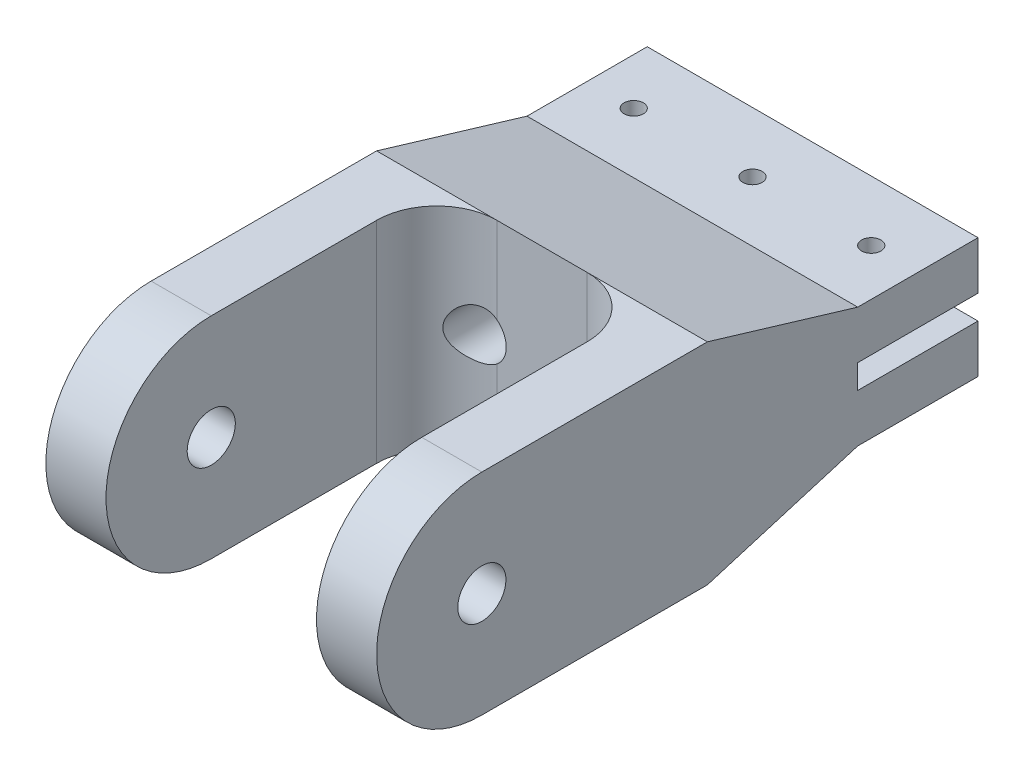
from build123d import *

# Parameters (mm, degrees)
CROQUIS1_W              = 55
CROQUIS1_H              = 35
SALIENTE_EXTRUIR1_DEPTH = 100
CROQUIS2_R              = 4
CORTAR_EXTRUIR1_DEPTH   = 100
CROQUIS3_W              = 35
CROQUIS3_H              = 55
CORTAR_EXTRUIR2_DEPTH   = 39
CROQUIS6_W              = 20
CROQUIS6_H              = 4
CORTAR_EXTRUIR3_DEPTH   = 55
CROQUIS7_R              = 4.05
CORTAR_EXTRUIR4_DEPTH   = 55
REDONDEO1_R             = 10
REDONDEO2_R             = 10
CROQUIS8_R              = 1.6
CORTAR_EXTRUIR5_DEPTH   = 20


with BuildPart() as part:
    # Croquis1 → Saliente-Extruir1 (new body)
    with BuildSketch(Plane.XY):
        Rectangle(CROQUIS1_W, CROQUIS1_H)
    extrude(amount=SALIENTE_EXTRUIR1_DEPTH)

    # Croquis2 → Cortar-Extruir1 (cut)
    with BuildSketch(Plane(origin=(27.5, 0, 0), x_dir=(0, 0, -1), z_dir=(1, 0, 0))):
        with Locations(Location((-82.5, 0, 0), (0, 0, 90))):
            Circle(CROQUIS2_R)
        with BuildLine():
            ThreePointArc((-100, 0), (-94.874368671, 12.374368671), (-82.5, 17.5))
            Line((-82.5, 17.5), (-100, 17.5))
            Line((-100, 17.5), (-100, 0))
        make_face()
        with BuildLine():
            ThreePointArc((-82.5, -17.5), (-94.874368671, -12.374368671), (-100, 0))
            Line((-100, 0), (-100, -17.5))
            Line((-100, -17.5), (-82.5, -17.5))
        make_face()
    extrude(amount=-CORTAR_EXTRUIR1_DEPTH, mode=Mode.SUBTRACT)

    # Croquis3 → Cortar-Extruir2 (cut)
    with BuildSketch(Plane(origin=(0, 17.5, 0), x_dir=(1, 0, 0), z_dir=(0, 1, 0))):
        with Locations((0, -72.5)):
            Rectangle(CROQUIS3_W, CROQUIS3_H)
    extrude(amount=-CORTAR_EXTRUIR2_DEPTH, mode=Mode.SUBTRACT)

    # Croquis6 → Cortar-Extruir3 (cut)
    with BuildSketch(Plane(origin=(27.5, 0, 0), x_dir=(0, 0, -1), z_dir=(1, 0, 0))):
        Polygon((-45, 17.5), (0, 17.5), (0, 10), (-20, 10), align=None)
        with Locations((-10, 0)):
            Rectangle(CROQUIS6_W, CROQUIS6_H)
        Polygon((-45, -17.5), (-20, -10), (0, -10), (0, -17.5), align=None)
    extrude(amount=-CORTAR_EXTRUIR3_DEPTH, mode=Mode.SUBTRACT)

    # Croquis7 → Cortar-Extruir4 (cut)
    with BuildSketch(Plane(origin=(0, 0, 0), x_dir=(-1, 0, 0), z_dir=(0, 0, -1))):
        with Locations((-10, 0)):
            Circle(CROQUIS7_R)
        with Locations((10, 0)):
            Circle(CROQUIS7_R)
    extrude(amount=-CORTAR_EXTRUIR4_DEPTH, mode=Mode.SUBTRACT)

    # Redondeo1
    # the kernel refuses this fillet: 10 mm, written as the material it adds along each edge
    with BuildSketch(Plane(origin=(-17.5, 17.5, 45), x_dir=(1, 0, 0), z_dir=(0, -1, 0))) as redondeo1_piece_1_section:
        with BuildLine():
            CenterArc((REDONDEO1_R, REDONDEO1_R), REDONDEO1_R, 180, 90)
            Line((0, REDONDEO1_R), (0, 0))
            Line((0, 0), (REDONDEO1_R, 0))
        make_face()
    redondeo1_piece_1 = extrude(amount=35, mode=Mode.PRIVATE)
    redondeo1_piece_1 = split(redondeo1_piece_1, bisect_by=Plane(origin=(-15.390656306, -16.700081338, 42.33360446), z_dir=(0, 0.9578262852211515, 0.2873478855663453)), keep=Keep.TOP, mode=Mode.PRIVATE)
    redondeo1_piece_1 = split(redondeo1_piece_1, bisect_by=Plane(origin=(-15.390656306, 16.700081275, 42.333604252), z_dir=(0, -0.9578262852211514, 0.28734788556634544)), keep=Keep.TOP, mode=Mode.PRIVATE)
    redondeo1_piece_1 = redondeo1_piece_1 - Plane(origin=(-10, 0, 47.343628748), x_dir=(-1, 0, 0), z_dir=(0, 0, -1)) * Cylinder(4.05, 110, mode=Mode.PRIVATE)
    add(redondeo1_piece_1)

    # Redondeo2
    # the kernel refuses this fillet: 10 mm, written as the material it adds along each edge
    with BuildSketch(Plane(origin=(17.5, 17.5, 45), x_dir=(0, 0, 1), z_dir=(0, -1, 0))) as redondeo2_piece_1_section:
        with BuildLine():
            CenterArc((REDONDEO2_R, REDONDEO2_R), REDONDEO2_R, 180, 90)
            Line((0, REDONDEO2_R), (0, 0))
            Line((0, 0), (REDONDEO2_R, 0))
        make_face()
    redondeo2_piece_1 = extrude(amount=35, mode=Mode.PRIVATE)
    redondeo2_piece_1 = redondeo2_piece_1 - Plane(origin=(10, 0, 47.343628624), x_dir=(-1, 0, 0), z_dir=(0, 0, -1)) * Cylinder(4.05, 110, mode=Mode.PRIVATE)
    redondeo2_piece_1 = split(redondeo2_piece_1, bisect_by=Plane(origin=(15.390657599, 16.700081065, 42.333603552), z_dir=(0, -0.9578262852211514, 0.28734788556634544)), keep=Keep.TOP, mode=Mode.PRIVATE)
    redondeo2_piece_1 = split(redondeo2_piece_1, bisect_by=Plane(origin=(15.390657599, -16.70008148, 42.333604932), z_dir=(0, 0.9578262852211515, 0.2873478855663453)), keep=Keep.TOP, mode=Mode.PRIVATE)
    add(redondeo2_piece_1)

    # Croquis8 → Cortar-Extruir5 (cut)
    with BuildSketch(Plane(origin=(0, 10, 0), x_dir=(1, 0, 0), z_dir=(0, 1, 0))):
        with Locations(Location((0, -10, 0), (0, 0, 180))):
            Circle(CROQUIS8_R)
        with Locations(Location((-19.75, -10, 0), (0, 0, 180))):
            Circle(CROQUIS8_R)
        with Locations(Location((19.75, -10, 0), (0, 0, 180))):
            Circle(CROQUIS8_R)
    extrude(amount=-CORTAR_EXTRUIR5_DEPTH, mode=Mode.SUBTRACT)


solid = part.part
